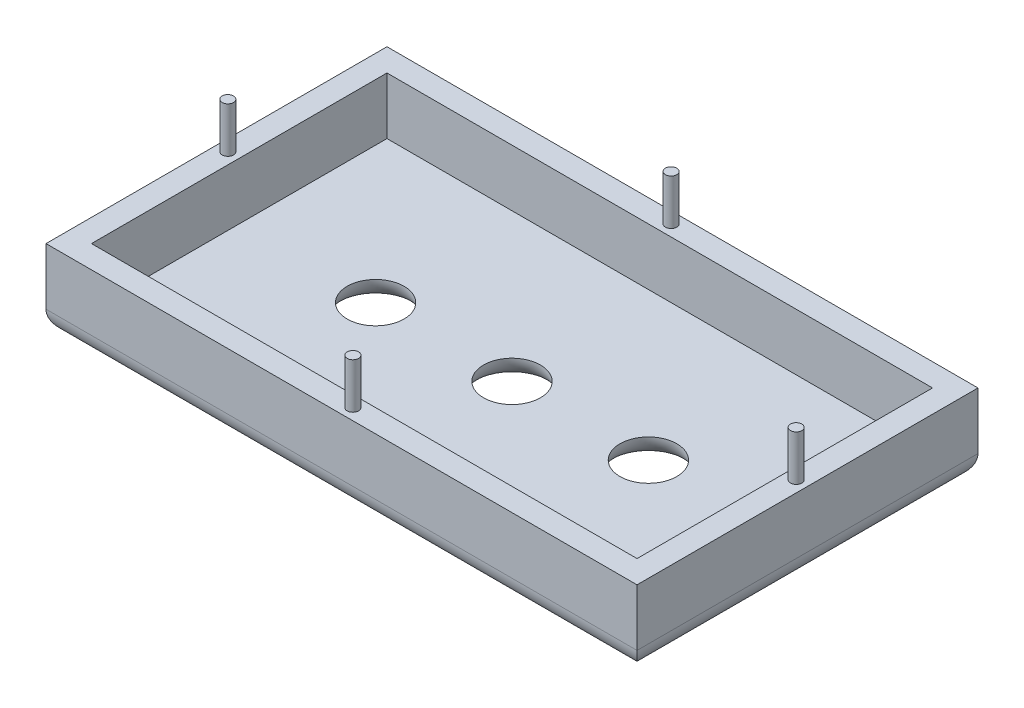
from build123d import *

# Parameters (mm, degrees)
SKETCH1_W           = 66.04
SKETCH1_H           = 38.1
BOSS_EXTRUDE3_DEPTH = 17.78
SKETCH3_W           = 60.96
SKETCH3_H           = 33.02
CUT_EXTRUDE1_DEPTH  = 15.24
SKETCH4_W           = 38.1
SKETCH4_H           = 8.89
CUT_EXTRUDE2_DEPTH  = 66.04
SKETCH5_R           = 0.635
BOSS_EXTRUDE4_DEPTH = 5.08
SKETCH6_R           = 3.175
CUT_EXTRUDE4_DEPTH  = 2.54
FILLET1_R           = 2.54


with BuildPart() as part:
    # Sketch1 → Boss-Extrude3 (new body)
    with BuildSketch(Plane(origin=(0, 0, 0), x_dir=(1, 0, 0), z_dir=(0, 1, 0))):
        with Locations((33.02, 19.05)):
            Rectangle(SKETCH1_W, SKETCH1_H)
    extrude(amount=BOSS_EXTRUDE3_DEPTH)

    # Sketch3 → Cut-Extrude1 (cut)
    with BuildSketch(Plane(origin=(0, 17.78, 0), x_dir=(1, 0, 0), z_dir=(0, 1, 0))):
        with Locations((33.02, 19.05)):
            Rectangle(SKETCH3_W, SKETCH3_H)
    extrude(amount=-CUT_EXTRUDE1_DEPTH, mode=Mode.SUBTRACT)

    # Sketch4 → Cut-Extrude2 (cut)
    with BuildSketch(Plane(origin=(66.04, 0, 0), x_dir=(0, 0, -1), z_dir=(1, 0, 0))):
        with Locations((19.05, 13.335)):
            Rectangle(SKETCH4_W, SKETCH4_H)
    extrude(amount=-CUT_EXTRUDE2_DEPTH, mode=Mode.SUBTRACT)

    # Sketch5 → Boss-Extrude4 (add)
    with BuildSketch(Plane(origin=(0, 8.89, 0), x_dir=(1, 0, 0), z_dir=(0, 1, 0))):
        with Locations(Location((33.02, 36.83, 0), (0, 0, 90))):
            Circle(SKETCH5_R)
        with Locations(Location((33.02, 1.27, 0), (0, 0, 90))):
            Circle(SKETCH5_R)
        with Locations(Location((1.27, 19.05, 0), (0, 0, 90))):
            Circle(SKETCH5_R)
        with Locations(Location((64.77, 19.05, 0), (0, 0, 90))):
            Circle(SKETCH5_R)
    extrude(amount=BOSS_EXTRUDE4_DEPTH)

    # Sketch6 → Cut-Extrude4 (cut)
    with BuildSketch(Plane.XZ):
        with Locations(Location((17.78, -19.05, 0), (0, 0, 270))):
            Circle(SKETCH6_R)
        with Locations(Location((33.02, -19.05, 0), (0, 0, 270))):
            Circle(SKETCH6_R)
        with Locations(Location((48.26, -19.05, 0), (0, 0, 270))):
            Circle(SKETCH6_R)
    extrude(amount=-CUT_EXTRUDE4_DEPTH, mode=Mode.SUBTRACT)

    # Fillet1
    fillet1_edges = [part.edges().sort_by_distance(p)[0] for p in [
        (33.02, 0, -38.1),
        (66.04, 0, -19.05),
        (33.02, 0, 0),
        (0, 0, -19.05),
        (17.78, 0, -15.875),
        (33.02, 0, -15.875),
        (48.26, 0, -15.875),
    ]]
    fillet(fillet1_edges, radius=FILLET1_R - 0.0001)  # a hair under: the kernel refuses the full size


solid = part.part
